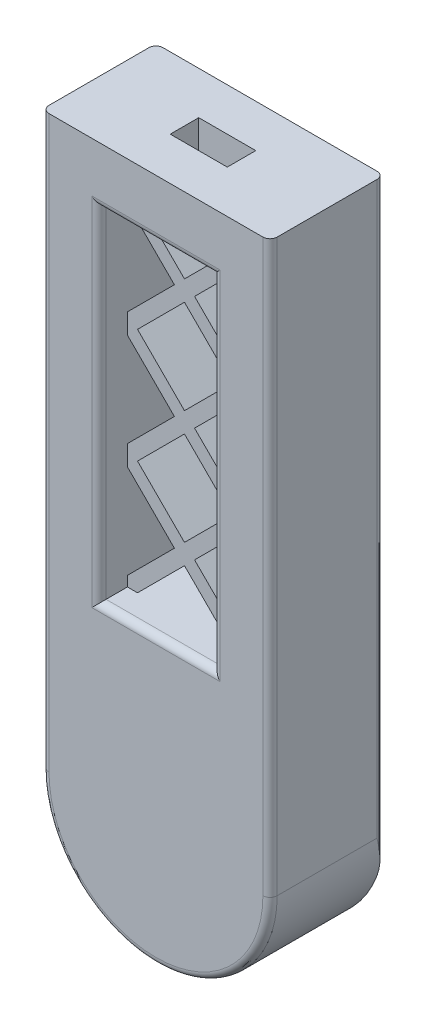
from build123d import *

# Parameters (mm, degrees)
SKETCH1_R                = 10
SKETCH1_W                = 20
SKETCH1_H                = 60
BOSS_EXTRUDE1_DEPTH      = 10
BOSS_EXTRUDE2_DEPTH      = 10
BOSS_EXTRUDE2_DEPTH_BACK = 5
SKETCH1_3_R              = 10
SKETCH3_W                = 10
SKETCH3_H                = 5
CUT_EXTRUDE1_DEPTH       = 5
BOSS_EXTRUDE3_DEPTH      = 5
FILLET1_R                = 1.25


with BuildPart() as part:
    # Sketch1 → Boss-Extrude1 (new, symmetric)
    with BuildSketch(Plane.XY):
        with BuildLine():
            Line((0, 0), (40, 0))
            Line((40, 0), (40, -100))
            ThreePointArc((40, -100), (20, -120), (0, -100))
            Line((0, -100), (0, 0))
        make_face()
        with Locations((20, -100)):
            Circle(SKETCH1_R, mode=Mode.SUBTRACT)
        with Locations((20, -40)):
            Rectangle(SKETCH1_W, SKETCH1_H, mode=Mode.SUBTRACT)
    extrude(amount=BOSS_EXTRUDE1_DEPTH, both=True)

    # Sketch1<3> → Boss-Extrude2 (add, two sides: drawn at the far end of the back side and taken through both)
    with BuildSketch(Plane.XY.offset(-BOSS_EXTRUDE2_DEPTH_BACK)):
        with Locations((20, -100)):
            Circle(SKETCH1_3_R)
    extrude(amount=BOSS_EXTRUDE2_DEPTH + BOSS_EXTRUDE2_DEPTH_BACK)

    # Sketch3 → Cut-Extrude1 (cut)
    with BuildSketch(Plane(origin=(0, 0, 0), x_dir=(1, 0, 0), z_dir=(0, 1, 0))):
        with Locations((20, 0)):
            Rectangle(SKETCH3_W, SKETCH3_H)
    extrude(amount=-CUT_EXTRUDE1_DEPTH, mode=Mode.SUBTRACT)

    # Sketch4 → Boss-Extrude3 (add, symmetric)
    with BuildSketch(Plane.XY):
        Polygon((11.767766953, -10), (31.767766953, -30), (11.767766953, -50), (30, -68.232233047), (30, -70), (28.232233047, -70), (8.232233047, -50), (28.232233047, -30), (10, -11.767766953), (10, -10), align=None)
        Polygon((11.767766953, -70), (10, -70), (10, -68.232233047), (28.232233047, -50), (8.232233047, -30), (28.232233047, -10), (30, -10), (30, -11.767766953), (11.767766953, -30), (31.767766953, -50), align=None)
    extrude(amount=BOSS_EXTRUDE3_DEPTH, both=True)

    # Fillet1
    # the kernel refuses this fillet: 1.25 mm, written as the material it takes off along each edge
    with BuildSketch(Plane(origin=(40, 3.125, 10), x_dir=(-1, 0, 0), z_dir=(0, -1, 0))) as fillet1_piece_1:
        with BuildLine():
            CenterArc((FILLET1_R, FILLET1_R), FILLET1_R, 180, 90)
            Line((0, FILLET1_R), (0, 0))
            Line((0, 0), (FILLET1_R, 0))
        make_face()
    extrude(amount=103.125, mode=Mode.SUBTRACT)
    with BuildSketch(Plane(origin=(30, -10, -10), x_dir=(0, 1, 0), z_dir=(-1, 0, 0)), Plane(origin=(10, -70, -10), x_dir=(0, -1, 0), z_dir=(1, 0, 0))) as fillet1_piece_2:
        with BuildLine():
            CenterArc((FILLET1_R, -FILLET1_R), FILLET1_R, 90, 90)
            Line((0, -FILLET1_R), (0, 0))
            Line((0, 0), (FILLET1_R, 0))
        make_face()
    extrude(amount=20, mode=Mode.SUBTRACT)
    with BuildSketch(Plane(origin=(10, -10, -10), x_dir=(-1, 0, 0), z_dir=(0, -1, 0)), Plane(origin=(30, -70, -10), x_dir=(1, 0, 0), z_dir=(0, 1, 0))) as fillet1_piece_3:
        with BuildLine():
            CenterArc((FILLET1_R, -FILLET1_R), FILLET1_R, 90, 90)
            Line((0, -FILLET1_R), (0, 0))
            Line((0, 0), (FILLET1_R, 0))
        make_face()
    extrude(amount=60, mode=Mode.SUBTRACT)
    with BuildSketch(Plane(origin=(30, -10, 10), x_dir=(0, 1, 0), z_dir=(-1, 0, 0)), Plane(origin=(10, -70, 10), x_dir=(0, -1, 0), z_dir=(1, 0, 0))) as fillet1_piece_4:
        with BuildLine():
            CenterArc((FILLET1_R, FILLET1_R), FILLET1_R, 180, 90)
            Line((0, FILLET1_R), (0, 0))
            Line((0, 0), (FILLET1_R, 0))
        make_face()
    extrude(amount=20, mode=Mode.SUBTRACT)
    with BuildSketch(Plane(origin=(10, -10, 10), x_dir=(-1, 0, 0), z_dir=(0, -1, 0)), Plane(origin=(30, -70, 10), x_dir=(1, 0, 0), z_dir=(0, 1, 0))) as fillet1_piece_5:
        with BuildLine():
            CenterArc((FILLET1_R, FILLET1_R), FILLET1_R, 180, 90)
            Line((0, FILLET1_R), (0, 0))
            Line((0, 0), (FILLET1_R, 0))
        make_face()
    extrude(amount=60, mode=Mode.SUBTRACT)
    with BuildSketch(Plane(origin=(0, -100, 10), x_dir=(0, 0, -1), z_dir=(0, 1, 0))) as fillet1_piece_6:
        with BuildLine():
            CenterArc((FILLET1_R, -FILLET1_R), FILLET1_R, 90, 90)
            Line((0, -FILLET1_R), (0, 0))
            Line((0, 0), (FILLET1_R, 0))
        make_face()
    extrude(amount=103.125, mode=Mode.SUBTRACT)
    with BuildSketch(Plane(origin=(40, 3.125, -10), x_dir=(-1, 0, 0), z_dir=(0, -1, 0))) as fillet1_piece_7:
        with BuildLine():
            CenterArc((FILLET1_R, -FILLET1_R), FILLET1_R, 90, 90)
            Line((0, -FILLET1_R), (0, 0))
            Line((0, 0), (FILLET1_R, 0))
        make_face()
    extrude(amount=112.5, mode=Mode.SUBTRACT)
    with BuildSketch(Plane(origin=(0, -109.375, -10), x_dir=(0, 0, 1), z_dir=(0, 1, 0))) as fillet1_piece_8:
        with BuildLine():
            CenterArc((FILLET1_R, FILLET1_R), FILLET1_R, 180, 90)
            Line((0, FILLET1_R), (0, 0))
            Line((0, 0), (FILLET1_R, 0))
        make_face()
    extrude(amount=112.5, mode=Mode.SUBTRACT)
    with BuildSketch(Plane(origin=(20, -100, 10), x_dir=(1, 0, 0), z_dir=(0, 1, 0))) as fillet1_piece_9:
        with BuildLine():
            CenterArc((20 - FILLET1_R, FILLET1_R), FILLET1_R, 270, 90)
            Line((20 - FILLET1_R, 0), (20, 0))
            Line((20, 0), (20, FILLET1_R))
        make_face()
    revolve(axis=Axis((20, -100, 10), (0, 0, -1)), revolution_arc=180, mode=Mode.SUBTRACT)
    with BuildSketch(Plane(origin=(30, -70, -10), x_dir=(1, 0, 0), z_dir=(0, 1, 0))) as fillet1_piece_10a_section:
        with BuildLine():
            CenterArc((FILLET1_R, -FILLET1_R), FILLET1_R, 90, 90)
            Line((0, -FILLET1_R), (0, 0))
            Line((0, 0), (FILLET1_R, 0))
        make_face()
    fillet1_piece_10a = extrude(amount=63.125, mode=Mode.PRIVATE)
    fillet1_piece_10a = split(fillet1_piece_10a, bisect_by=Plane(origin=(30, -10, -10), z_dir=(0, 1, 0)), keep=Keep.TOP, mode=Mode.PRIVATE)
    with BuildSketch(Plane(origin=(33.125, -10, -10), x_dir=(0, 1, 0), z_dir=(-1, 0, 0))) as fillet1_piece_10b_section:
        with BuildLine():
            CenterArc((FILLET1_R, -FILLET1_R), FILLET1_R, 90, 90)
            Line((0, -FILLET1_R), (0, 0))
            Line((0, 0), (FILLET1_R, 0))
        make_face()
    fillet1_piece_10b = extrude(amount=23.125, mode=Mode.PRIVATE)
    fillet1_piece_10b = split(fillet1_piece_10b, bisect_by=Plane(origin=(30, -10, -10), z_dir=(1, 0, 0)), keep=Keep.TOP, mode=Mode.PRIVATE)
    fillet1_piece_10 = fillet1_piece_10a & fillet1_piece_10b
    add(fillet1_piece_10, mode=Mode.SUBTRACT)
    with BuildSketch(Plane(origin=(10, -6.875, -10), x_dir=(-1, 0, 0), z_dir=(0, -1, 0))) as fillet1_piece_11a_section:
        with BuildLine():
            CenterArc((FILLET1_R, -FILLET1_R), FILLET1_R, 90, 90)
            Line((0, -FILLET1_R), (0, 0))
            Line((0, 0), (FILLET1_R, 0))
        make_face()
    fillet1_piece_11a = extrude(amount=63.125, mode=Mode.PRIVATE)
    fillet1_piece_11a = split(fillet1_piece_11a, bisect_by=Plane(origin=(10, -10, -10), z_dir=(0, 1, 0)), keep=Keep.TOP, mode=Mode.PRIVATE)
    with BuildSketch(Plane(origin=(30, -10, -10), x_dir=(0, 1, 0), z_dir=(-1, 0, 0))) as fillet1_piece_11b_section:
        with BuildLine():
            CenterArc((FILLET1_R, -FILLET1_R), FILLET1_R, 90, 90)
            Line((0, -FILLET1_R), (0, 0))
            Line((0, 0), (FILLET1_R, 0))
        make_face()
    fillet1_piece_11b = extrude(amount=23.125, mode=Mode.PRIVATE)
    fillet1_piece_11b = split(fillet1_piece_11b, bisect_by=Plane(origin=(10, -10, -10), z_dir=(-1, 0, 0)), keep=Keep.TOP, mode=Mode.PRIVATE)
    fillet1_piece_11 = fillet1_piece_11a & fillet1_piece_11b
    add(fillet1_piece_11, mode=Mode.SUBTRACT)
    with BuildSketch(Plane(origin=(10, -10, -10), x_dir=(-1, 0, 0), z_dir=(0, -1, 0))) as fillet1_piece_12a_section:
        with BuildLine():
            CenterArc((FILLET1_R, -FILLET1_R), FILLET1_R, 90, 90)
            Line((0, -FILLET1_R), (0, 0))
            Line((0, 0), (FILLET1_R, 0))
        make_face()
    fillet1_piece_12a = extrude(amount=63.125, mode=Mode.PRIVATE)
    fillet1_piece_12a = split(fillet1_piece_12a, bisect_by=Plane(origin=(10, -70, -10), z_dir=(0, -1, 0)), keep=Keep.TOP, mode=Mode.PRIVATE)
    with BuildSketch(Plane(origin=(6.875, -70, -10), x_dir=(0, -1, 0), z_dir=(1, 0, 0))) as fillet1_piece_12b_section:
        with BuildLine():
            CenterArc((FILLET1_R, -FILLET1_R), FILLET1_R, 90, 90)
            Line((0, -FILLET1_R), (0, 0))
            Line((0, 0), (FILLET1_R, 0))
        make_face()
    fillet1_piece_12b = extrude(amount=23.125, mode=Mode.PRIVATE)
    fillet1_piece_12b = split(fillet1_piece_12b, bisect_by=Plane(origin=(10, -70, -10), z_dir=(-1, 0, 0)), keep=Keep.TOP, mode=Mode.PRIVATE)
    fillet1_piece_12 = fillet1_piece_12a & fillet1_piece_12b
    add(fillet1_piece_12, mode=Mode.SUBTRACT)
    with BuildSketch(Plane(origin=(10, -70, -10), x_dir=(0, -1, 0), z_dir=(1, 0, 0))) as fillet1_piece_13a_section:
        with BuildLine():
            CenterArc((FILLET1_R, -FILLET1_R), FILLET1_R, 90, 90)
            Line((0, -FILLET1_R), (0, 0))
            Line((0, 0), (FILLET1_R, 0))
        make_face()
    fillet1_piece_13a = extrude(amount=23.125, mode=Mode.PRIVATE)
    fillet1_piece_13a = split(fillet1_piece_13a, bisect_by=Plane(origin=(30, -70, -10), z_dir=(1, 0, 0)), keep=Keep.TOP, mode=Mode.PRIVATE)
    with BuildSketch(Plane(origin=(30, -73.125, -10), x_dir=(1, 0, 0), z_dir=(0, 1, 0))) as fillet1_piece_13b_section:
        with BuildLine():
            CenterArc((FILLET1_R, -FILLET1_R), FILLET1_R, 90, 90)
            Line((0, -FILLET1_R), (0, 0))
            Line((0, 0), (FILLET1_R, 0))
        make_face()
    fillet1_piece_13b = extrude(amount=63.125, mode=Mode.PRIVATE)
    fillet1_piece_13b = split(fillet1_piece_13b, bisect_by=Plane(origin=(30, -70, -10), z_dir=(0, -1, 0)), keep=Keep.TOP, mode=Mode.PRIVATE)
    fillet1_piece_13 = fillet1_piece_13a & fillet1_piece_13b
    add(fillet1_piece_13, mode=Mode.SUBTRACT)
    with BuildSketch(Plane(origin=(30, -70, 10), x_dir=(1, 0, 0), z_dir=(0, 1, 0))) as fillet1_piece_14a_section:
        with BuildLine():
            CenterArc((FILLET1_R, FILLET1_R), FILLET1_R, 180, 90)
            Line((0, FILLET1_R), (0, 0))
            Line((0, 0), (FILLET1_R, 0))
        make_face()
    fillet1_piece_14a = extrude(amount=63.125, mode=Mode.PRIVATE)
    fillet1_piece_14a = split(fillet1_piece_14a, bisect_by=Plane(origin=(30, -10, 10), z_dir=(0, 1, 0)), keep=Keep.TOP, mode=Mode.PRIVATE)
    with BuildSketch(Plane(origin=(33.125, -10, 10), x_dir=(0, 1, 0), z_dir=(-1, 0, 0))) as fillet1_piece_14b_section:
        with BuildLine():
            CenterArc((FILLET1_R, FILLET1_R), FILLET1_R, 180, 90)
            Line((0, FILLET1_R), (0, 0))
            Line((0, 0), (FILLET1_R, 0))
        make_face()
    fillet1_piece_14b = extrude(amount=23.125, mode=Mode.PRIVATE)
    fillet1_piece_14b = split(fillet1_piece_14b, bisect_by=Plane(origin=(30, -10, 10), z_dir=(1, 0, 0)), keep=Keep.TOP, mode=Mode.PRIVATE)
    fillet1_piece_14 = fillet1_piece_14a & fillet1_piece_14b
    add(fillet1_piece_14, mode=Mode.SUBTRACT)
    with BuildSketch(Plane(origin=(10, -6.875, 10), x_dir=(-1, 0, 0), z_dir=(0, -1, 0))) as fillet1_piece_15a_section:
        with BuildLine():
            CenterArc((FILLET1_R, FILLET1_R), FILLET1_R, 180, 90)
            Line((0, FILLET1_R), (0, 0))
            Line((0, 0), (FILLET1_R, 0))
        make_face()
    fillet1_piece_15a = extrude(amount=63.125, mode=Mode.PRIVATE)
    fillet1_piece_15a = split(fillet1_piece_15a, bisect_by=Plane(origin=(10, -10, 10), z_dir=(0, 1, 0)), keep=Keep.TOP, mode=Mode.PRIVATE)
    with BuildSketch(Plane(origin=(30, -10, 10), x_dir=(0, 1, 0), z_dir=(-1, 0, 0))) as fillet1_piece_15b_section:
        with BuildLine():
            CenterArc((FILLET1_R, FILLET1_R), FILLET1_R, 180, 90)
            Line((0, FILLET1_R), (0, 0))
            Line((0, 0), (FILLET1_R, 0))
        make_face()
    fillet1_piece_15b = extrude(amount=23.125, mode=Mode.PRIVATE)
    fillet1_piece_15b = split(fillet1_piece_15b, bisect_by=Plane(origin=(10, -10, 10), z_dir=(-1, 0, 0)), keep=Keep.TOP, mode=Mode.PRIVATE)
    fillet1_piece_15 = fillet1_piece_15a & fillet1_piece_15b
    add(fillet1_piece_15, mode=Mode.SUBTRACT)
    with BuildSketch(Plane(origin=(10, -10, 10), x_dir=(-1, 0, 0), z_dir=(0, -1, 0))) as fillet1_piece_16a_section:
        with BuildLine():
            CenterArc((FILLET1_R, FILLET1_R), FILLET1_R, 180, 90)
            Line((0, FILLET1_R), (0, 0))
            Line((0, 0), (FILLET1_R, 0))
        make_face()
    fillet1_piece_16a = extrude(amount=63.125, mode=Mode.PRIVATE)
    fillet1_piece_16a = split(fillet1_piece_16a, bisect_by=Plane(origin=(10, -70, 10), z_dir=(0, -1, 0)), keep=Keep.TOP, mode=Mode.PRIVATE)
    with BuildSketch(Plane(origin=(6.875, -70, 10), x_dir=(0, -1, 0), z_dir=(1, 0, 0))) as fillet1_piece_16b_section:
        with BuildLine():
            CenterArc((FILLET1_R, FILLET1_R), FILLET1_R, 180, 90)
            Line((0, FILLET1_R), (0, 0))
            Line((0, 0), (FILLET1_R, 0))
        make_face()
    fillet1_piece_16b = extrude(amount=23.125, mode=Mode.PRIVATE)
    fillet1_piece_16b = split(fillet1_piece_16b, bisect_by=Plane(origin=(10, -70, 10), z_dir=(-1, 0, 0)), keep=Keep.TOP, mode=Mode.PRIVATE)
    fillet1_piece_16 = fillet1_piece_16a & fillet1_piece_16b
    add(fillet1_piece_16, mode=Mode.SUBTRACT)
    with BuildSketch(Plane(origin=(10, -70, 10), x_dir=(0, -1, 0), z_dir=(1, 0, 0))) as fillet1_piece_17a_section:
        with BuildLine():
            CenterArc((FILLET1_R, FILLET1_R), FILLET1_R, 180, 90)
            Line((0, FILLET1_R), (0, 0))
            Line((0, 0), (FILLET1_R, 0))
        make_face()
    fillet1_piece_17a = extrude(amount=23.125, mode=Mode.PRIVATE)
    fillet1_piece_17a = split(fillet1_piece_17a, bisect_by=Plane(origin=(30, -70, 10), z_dir=(1, 0, 0)), keep=Keep.TOP, mode=Mode.PRIVATE)
    with BuildSketch(Plane(origin=(30, -73.125, 10), x_dir=(1, 0, 0), z_dir=(0, 1, 0))) as fillet1_piece_17b_section:
        with BuildLine():
            CenterArc((FILLET1_R, FILLET1_R), FILLET1_R, 180, 90)
            Line((0, FILLET1_R), (0, 0))
            Line((0, 0), (FILLET1_R, 0))
        make_face()
    fillet1_piece_17b = extrude(amount=63.125, mode=Mode.PRIVATE)
    fillet1_piece_17b = split(fillet1_piece_17b, bisect_by=Plane(origin=(30, -70, 10), z_dir=(0, -1, 0)), keep=Keep.TOP, mode=Mode.PRIVATE)
    fillet1_piece_17 = fillet1_piece_17a & fillet1_piece_17b
    add(fillet1_piece_17, mode=Mode.SUBTRACT)


solid = part.part
